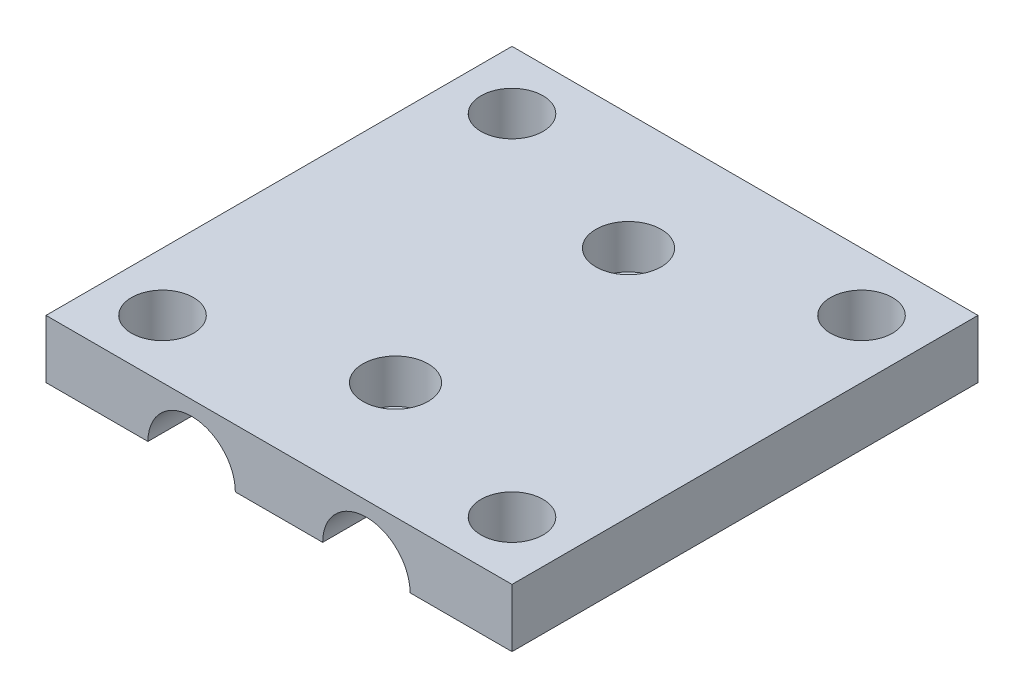
from build123d import *

# Parameters (mm, degrees)
SKETCH1_W               = 50.8
SKETCH1_H               = 50.8
BOSS_EXTRUDE1_DEPTH     = 6.35
SKETCH2_R               = 4.7625
CUT_EXTRUDE1_DEPTH      = 58.15
F_1_4_CLEARANCE_HOLE1_D = 6.7564
F_8_CLEARANCE_HOLE1_D   = 4.4958
SKETCH10_R              = 3.556
CUT_EXTRUDE2_DEPTH      = 4.7625


with BuildPart() as part:
    # Sketch1 → Boss-Extrude1 (new body)
    with BuildSketch(Plane(origin=(0, 0, 0), x_dir=(1, 0, 0), z_dir=(0, 1, 0))):
        Rectangle(SKETCH1_W, SKETCH1_H)
    extrude(amount=BOSS_EXTRUDE1_DEPTH)

    # Sketch2 → Cut-Extrude1 (cut, through all)
    with BuildSketch(Plane.XY.offset(25.4)):
        with Locations((-9.525, 0)):
            Circle(SKETCH2_R)
        with Locations((9.525, 0)):
            Circle(SKETCH2_R)
    extrude(amount=-CUT_EXTRUDE1_DEPTH, mode=Mode.SUBTRACT)

    # 1/4 Clearance Hole1 (through all)
    with Locations(Plane(origin=(0, 6.35, 0), x_dir=(1, 0, 0), z_dir=(0, 1, 0))):
        with Locations((-19.05, -19.05), (-19.05, 19.05), (19.05, 19.05), (19.05, -19.05)):
            Hole(F_1_4_CLEARANCE_HOLE1_D / 2)

    # #8 Clearance Hole1 (through all)
    with Locations(Plane(origin=(0, 6.35, 0), x_dir=(1, 0, 0), z_dir=(0, 1, 0))):
        with Locations((0, 12.7), (0, -12.7)):
            Hole(F_8_CLEARANCE_HOLE1_D / 2)

    # Sketch10 → Cut-Extrude2 (cut)
    with BuildSketch(Plane(origin=(0, 6.35, 0), x_dir=(1, 0, 0), z_dir=(0, 1, 0))):
        with Locations((0, 12.7)):
            Circle(SKETCH10_R)
        with Locations((0, -12.7)):
            Circle(SKETCH10_R)
    extrude(amount=-CUT_EXTRUDE2_DEPTH, mode=Mode.SUBTRACT)


solid = part.part
